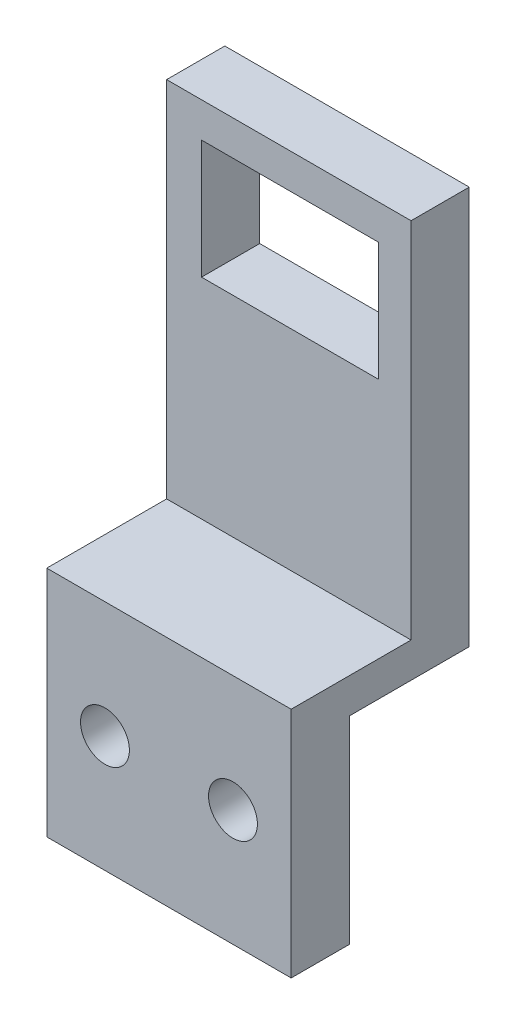
from build123d import *

# Parameters (mm, degrees)
SKETCH1_W           = 21
SKETCH1_H           = 51.2
SKETCH1_R           = 2.1
SKETCH1_W_2         = 15.2
SKETCH1_H_2         = 10.2
BOSS_EXTRUDE1_DEPTH = 15.3
SKETCH2_W           = 10.3
SKETCH2_H           = 31.2
SKETCH2_H_2         = 17
CUT_EXTRUDE1_DEPTH  = 21


with BuildPart() as part:
    # Sketch1 → Boss-Extrude1 (new body)
    with BuildSketch(Plane.XY):
        with Locations((10.5, 25.6)):
            Rectangle(SKETCH1_W, SKETCH1_H)
        with Locations((5, 10)):
            Circle(SKETCH1_R, mode=Mode.SUBTRACT)
        with Locations((16, 10)):
            Circle(SKETCH1_R, mode=Mode.SUBTRACT)
        with Locations((10.6, 43.1)):
            Rectangle(SKETCH1_W_2, SKETCH1_H_2, mode=Mode.SUBTRACT)
    extrude(amount=BOSS_EXTRUDE1_DEPTH)

    # Sketch2 → Cut-Extrude1 (cut)
    with BuildSketch(Plane.ZY):
        with Locations((10.15, 35.6)):
            Rectangle(SKETCH2_W, SKETCH2_H)
        with Locations((5.15, 8.5)):
            Rectangle(SKETCH2_W, SKETCH2_H_2)
    extrude(amount=-CUT_EXTRUDE1_DEPTH, mode=Mode.SUBTRACT)


solid = part.part
